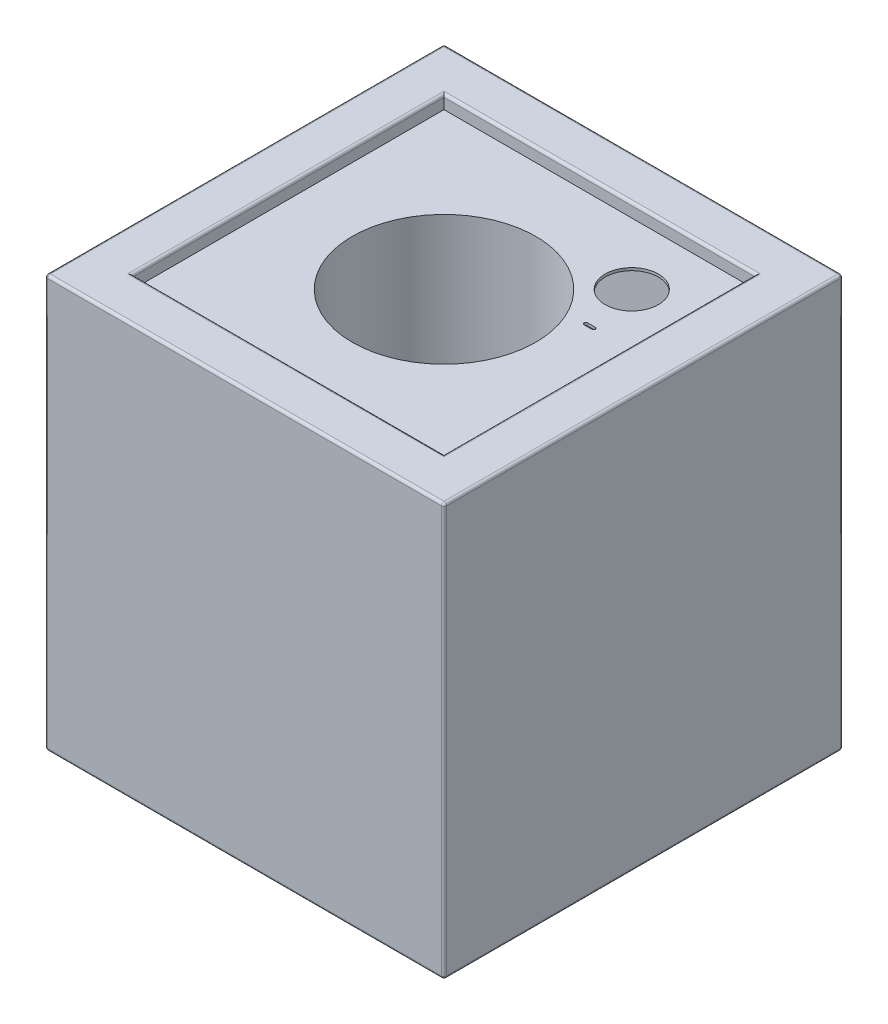
from build123d import *

# Parameters (mm, degrees)
SKETCH2_W               = 300
SKETCH2_H               = 300
BOSS_EXTRUDE1_DEPTH     = 10
SKETCH3_W               = 300
SKETCH3_H               = 300
SKETCH3_W_2             = 280
SKETCH3_H_2             = 280
BOSS_EXTRUDE2_DEPTH     = 290
SKETCH4_W               = 274
SKETCH4_H               = 274
BOSS_EXTRUDE3_DEPTH     = 10
SKETCH5_W               = 274
SKETCH5_H               = 274
SKETCH5_W_2             = 254
SKETCH5_H_2             = 254
BOSS_EXTRUDE4_DEPTH     = 277
SKETCH6_W               = 234
SKETCH6_H               = 234
BOSS_EXTRUDE5_DEPTH     = 20
SKETCH7_W               = 234
SKETCH7_H               = 234
SKETCH7_W_2             = 194
SKETCH7_H_2             = 194
BOSS_EXTRUDE6_DEPTH     = 247
SKETCH8_R               = 71
BOSS_EXTRUDE7_DEPTH     = 2
SKETCH9_R               = 71
SKETCH9_R_2             = 69
BOSS_EXTRUDE8_DEPTH     = 245
SKETCH10_W              = 194
SKETCH10_H              = 194
SKETCH10_R              = 71
BOSS_EXTRUDE9_DEPTH     = 2
SKETCH11_W              = 194
SKETCH11_H              = 194
SKETCH11_W_2            = 190
SKETCH11_H_2            = 190
BOSS_EXTRUDE11_DEPTH    = 52
CUT_EXTRUDE1_DEPTH      = 200
CUT_EXTRUDE1_DEPTH_BACK = 52
SKETCH12_R              = 20
SKETCH16_R              = 73
SKETCH16_R_2            = 71
BOSS_EXTRUDE14_DEPTH    = 52
SKETCH17_W              = 194
SKETCH17_H              = 194
SKETCH17_R              = 69
BOSS_EXTRUDE15_DEPTH    = 2
SKETCH18_W              = 300
SKETCH18_H              = 300
SKETCH18_W_2            = 234
SKETCH18_H_2            = 234
BOSS_EXTRUDE16_DEPTH    = 10
FILLET1_R               = 2
CUT_EXTRUDE6_START      = 298
CUT_EXTRUDE6_OUTLINE_R  = 20
CUT_EXTRUDE6_DEPTH      = 2
SKETCH21_R              = 1.5
CUT_EXTRUDE7_DEPTH      = 10
SKETCH22_W              = 8.4
SKETCH22_H              = 2.6
CUT_EXTRUDE8_DEPTH      = 10
FILLET2_R               = 1.3


# Read off the part's stored shape, not the designer's step: Cut-Extrude6
with BuildPart() as part:
    # Sketch2 → Boss-Extrude1 (new body)
    with BuildSketch(Plane(origin=(0, 0, 0), x_dir=(1, 0, 0), z_dir=(0, 1, 0))):
        Rectangle(SKETCH2_W, SKETCH2_H)
    extrude(amount=BOSS_EXTRUDE1_DEPTH)

    # Sketch3 → Boss-Extrude2 (add)
    with BuildSketch(Plane(origin=(0, 10, 0), x_dir=(1, 0, 0), z_dir=(0, 1, 0))):
        Rectangle(SKETCH3_W, SKETCH3_H)
        Rectangle(SKETCH3_W_2, SKETCH3_H_2, mode=Mode.SUBTRACT)
    extrude(amount=BOSS_EXTRUDE2_DEPTH)



with BuildPart() as body_2:
    # Sketch4 → Boss-Extrude3 (new body)
    with BuildSketch(Plane(origin=(0, 13, 0), x_dir=(1, 0, 0), z_dir=(0, 1, 0))):
        Rectangle(SKETCH4_W, SKETCH4_H)
    extrude(amount=BOSS_EXTRUDE3_DEPTH)

    # Sketch5 → Boss-Extrude4 (add)
    with BuildSketch(Plane(origin=(0, 23, 0), x_dir=(1, 0, 0), z_dir=(0, 1, 0))):
        Rectangle(SKETCH5_W, SKETCH5_H)
        Rectangle(SKETCH5_W_2, SKETCH5_H_2, mode=Mode.SUBTRACT)
    extrude(amount=BOSS_EXTRUDE4_DEPTH)


with BuildPart() as body_3:
    # Sketch6 → Boss-Extrude5 (new body)
    with BuildSketch(Plane(origin=(0, 33, 0), x_dir=(1, 0, 0), z_dir=(0, 1, 0))):
        Rectangle(SKETCH6_W, SKETCH6_H)
    extrude(amount=BOSS_EXTRUDE5_DEPTH)

    # Sketch7 → Boss-Extrude6 (add)
    with BuildSketch(Plane(origin=(0, 53, 0), x_dir=(1, 0, 0), z_dir=(0, 1, 0))):
        Rectangle(SKETCH7_W, SKETCH7_H)
        Rectangle(SKETCH7_W_2, SKETCH7_H_2, mode=Mode.SUBTRACT)
    extrude(amount=BOSS_EXTRUDE6_DEPTH)

    # Sketch8 → Boss-Extrude7 (add)
    with BuildSketch(Plane(origin=(0, 53, 0), x_dir=(1, 0, 0), z_dir=(0, 1, 0))):
        with Locations(Location((0, 0, 0), (0, 0, 270))):
            Circle(SKETCH8_R)
    extrude(amount=BOSS_EXTRUDE7_DEPTH)

    # Sketch9 → Boss-Extrude8 (add)
    with BuildSketch(Plane(origin=(0, 55, 0), x_dir=(1, 0, 0), z_dir=(0, 1, 0))):
        with Locations(Location((0, 0, 0), (0, 0, 270))):
            Circle(SKETCH9_R)
        with Locations(Location((0, 0, 0), (0, 0, 270))):
            Circle(SKETCH9_R_2, mode=Mode.SUBTRACT)
    extrude(amount=BOSS_EXTRUDE8_DEPTH)

    # Sketch10 → Boss-Extrude9 (add)
    with BuildSketch(Plane(origin=(0, 244, 0), x_dir=(1, 0, 0), z_dir=(0, 1, 0))):
        Rectangle(SKETCH10_W, SKETCH10_H)
        with Locations(Location((0, 0, 0), (0, 0, 270))):
            Circle(SKETCH10_R, mode=Mode.SUBTRACT)
    extrude(amount=BOSS_EXTRUDE9_DEPTH)

    # Sketch11 → Boss-Extrude11 (add)
    with BuildSketch(Plane(origin=(0, 246, 0), x_dir=(1, 0, 0), z_dir=(0, 1, 0))):
        Rectangle(SKETCH11_W, SKETCH11_H)
        Rectangle(SKETCH11_W_2, SKETCH11_H_2, mode=Mode.SUBTRACT)
    extrude(amount=BOSS_EXTRUDE11_DEPTH)

    # Sketch12 → Cut-Extrude1 (cut, two sides: drawn at the far end of the back side and taken through both)
    with BuildSketch(Plane(origin=(0, 246, 0), x_dir=(1, 0, 0), z_dir=(0, 1, 0)).offset(-CUT_EXTRUDE1_DEPTH_BACK)):
        with Locations(Location((70.592917245, 70.592917245, 0), (0, 0, 270))):
            Circle(SKETCH12_R)
    extrude(amount=CUT_EXTRUDE1_DEPTH + CUT_EXTRUDE1_DEPTH_BACK, mode=Mode.SUBTRACT)

    # Sketch16 → Boss-Extrude14 (add)
    with BuildSketch(Plane(origin=(0, 246, 0), x_dir=(1, 0, 0), z_dir=(0, 1, 0))):
        with Locations(Location((0, 0, 0), (0, 0, 270))):
            Circle(SKETCH16_R)
        with Locations(Location((0, 0, 0), (0, 0, 270))):
            Circle(SKETCH16_R_2, mode=Mode.SUBTRACT)
    extrude(amount=BOSS_EXTRUDE14_DEPTH)

    # Sketch17 → Boss-Extrude15 (add)
    with BuildSketch(Plane(origin=(0, 298, 0), x_dir=(1, 0, 0), z_dir=(0, 1, 0))):
        Rectangle(SKETCH17_W, SKETCH17_H)
        with Locations(Location((0, 0, 0), (0, 0, 270))):
            Circle(SKETCH17_R, mode=Mode.SUBTRACT)
    extrude(amount=BOSS_EXTRUDE15_DEPTH)

    # Cut-Extrude6 outline → Cut-Extrude6 (cut)
    with BuildSketch(Plane(origin=(0, 0, 0), x_dir=(1, 0, 0), z_dir=(0, 1, 0)).offset(CUT_EXTRUDE6_START)):
        with Locations((70.592917245, 70.592917245)):
            Circle(CUT_EXTRUDE6_OUTLINE_R)
    extrude(amount=CUT_EXTRUDE6_DEPTH, mode=Mode.SUBTRACT)

    # Sketch21 → Cut-Extrude7 (cut)
    with BuildSketch(Plane(origin=(0, 246, 0), x_dir=(1, 0, 0), z_dir=(0, 1, 0))):
        with Locations(Location((80.612449639, 39.466675366, 0), (0, 0, 270))):
            Circle(SKETCH21_R)
    extrude(amount=-CUT_EXTRUDE7_DEPTH, mode=Mode.SUBTRACT)

    # Sketch22 → Cut-Extrude8 (cut)
    with BuildSketch(Plane(origin=(0, 300, 0), x_dir=(1, 0, 0), z_dir=(0, 1, 0))):
        with Locations((78.71084614, 30.862042528)):
            Rectangle(SKETCH22_W, SKETCH22_H)
    extrude(amount=-CUT_EXTRUDE8_DEPTH, mode=Mode.SUBTRACT)

    # Fillet2
    fillet2_edges = [body_3.edges().sort_by_distance(p)[0] for p in [
        (82.91084614, 299, -29.562042528),
        (74.51084614, 299, -29.562042528),
        (74.51084614, 299, -32.162042528),
        (82.91084614, 299, -32.162042528),
    ]]
    fillet(fillet2_edges, radius=FILLET2_R - 0.0001)  # a hair under: the kernel refuses the full size


with BuildPart() as part_1:
    add(part.part)

    add(body_2.part)  # Boss-Extrude16 merges body 2
    # Sketch18 → Boss-Extrude16 (add)
    with BuildSketch(Plane(origin=(0, 300, 0), x_dir=(1, 0, 0), z_dir=(0, 1, 0))):
        Rectangle(SKETCH18_W, SKETCH18_H)
        Rectangle(SKETCH18_W_2, SKETCH18_H_2, mode=Mode.SUBTRACT)
    extrude(amount=BOSS_EXTRUDE16_DEPTH)

    # Fillet1
    fillet1_edges = [part_1.edges().sort_by_distance(p)[0] for p in [
        (150, 310, 0),
        (0, 310, -150),
        (-150, 310, 0),
        (0, 310, 150),
        (117, 310, 0),
        (0, 310, -117),
        (-117, 310, 0),
        (0, 310, 117),
        (0, 0, 150),
        (-150, 0, 0),
        (0, 0, -150),
        (150, 0, 0),
        (150, 155, 150),
        (-150, 155, 150),
        (-150, 155, -150),
        (150, 155, -150),
    ]]
    fillet(fillet1_edges, radius=FILLET1_R)


solid = Compound([body_3.part, part_1.part])
